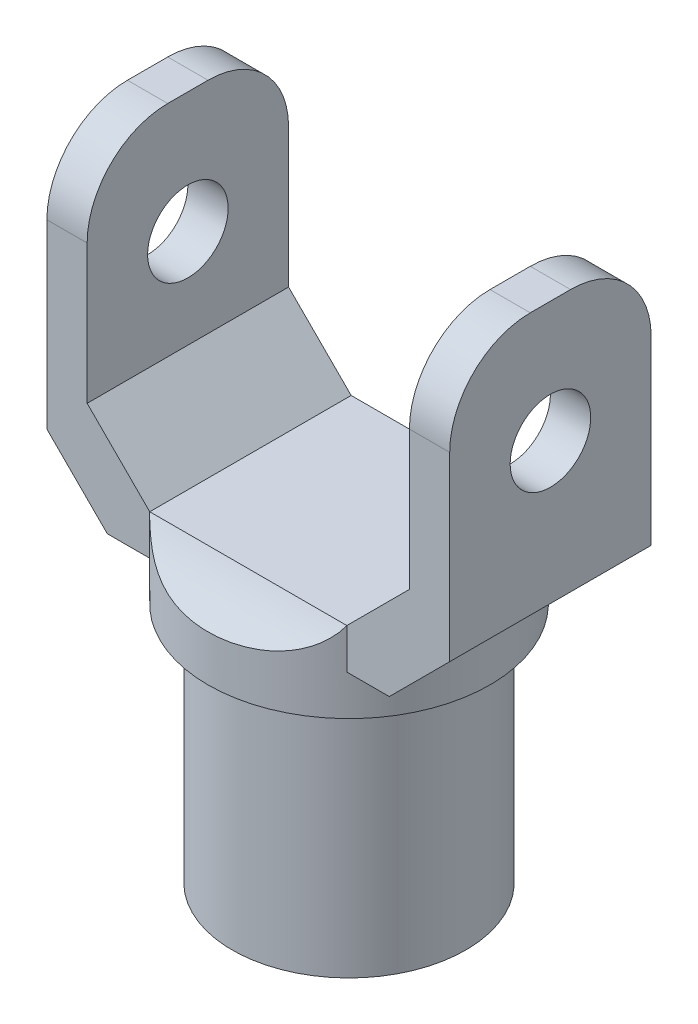
from build123d import *

# Parameters (mm, degrees)
SKETCH2_R           = 18.415
SKETCH2_R_2         = 15.875
BOSS_EXTRUDE1_DEPTH = 38.1
SKETCH3_R           = 22.225
BOSS_EXTRUDE2_DEPTH = 6.35
SKETCH5_W           = 63.5
SKETCH5_H           = 31.75
BOSS_EXTRUDE3_DEPTH = 50.8
CUT_EXTRUDE2_DEPTH  = 50.8
FILLET1_R           = 12.7
SKETCH9_R           = 6.35
CUT_EXTRUDE3_DEPTH  = 117.613734719
FILLET2_R           = 12.7


with BuildPart() as part:
    # Sketch2 → Boss-Extrude1 (new body)
    with BuildSketch(Plane(origin=(0, 0, 0), x_dir=(1, 0, 0), z_dir=(0, 1, 0))):
        with Locations(Location((0, 0, 0), (0, 0, 90))):
            Circle(SKETCH2_R)
        with Locations(Location((0, 0, 0), (0, 0, 90))):
            Circle(SKETCH2_R_2, mode=Mode.SUBTRACT)
    extrude(amount=BOSS_EXTRUDE1_DEPTH)

    # Sketch3 → Boss-Extrude2 (add)
    with BuildSketch(Plane(origin=(0, 38.1, 0), x_dir=(1, 0, 0), z_dir=(0, 1, 0))):
        with Locations(Location((0, 0, 0), (0, 0, 270))):
            Circle(SKETCH3_R)
    extrude(amount=BOSS_EXTRUDE2_DEPTH)

    # Sketch5 → Boss-Extrude3 (add)
    with BuildSketch(Plane(origin=(0, 44.45, 0), x_dir=(1, 0, 0), z_dir=(0, 1, 0))):
        Rectangle(SKETCH5_W, SKETCH5_H)
    extrude(amount=BOSS_EXTRUDE3_DEPTH)

    # Sketch7 → Cut-Extrude2 (cut)
    with BuildSketch(Plane.XY.offset(15.875)):
        Polygon((25.4, 95.25), (-25.4, 95.25), (-25.4, 60.667652482), (-15.532347518, 50.8), (15.532347518, 50.8), (25.4, 60.667652482), align=None)
        Polygon((-22.225, 44.45), (-31.75, 53.975), (-31.75, 44.45), align=None)
        Polygon((22.225, 44.45), (31.75, 53.975), (31.75, 44.45), align=None)
    extrude(amount=-CUT_EXTRUDE2_DEPTH, mode=Mode.SUBTRACT)

    # Fillet1
    fillet1_edges = [part.edges().sort_by_distance(p)[0] for p in [
        (28.575, 95.25, -15.875),
        (-28.575, 95.25, 15.875),
        (-28.575, 95.25, -15.875),
        (28.575, 95.25, 15.875),
    ]]
    fillet(fillet1_edges, radius=FILLET1_R)

    # Sketch9 → Cut-Extrude3 (cut, through all)
    with BuildSketch(Plane.ZY.offset(31.75)):
        with Locations((0, 76.2)):
            Circle(SKETCH9_R)
    extrude(amount=-CUT_EXTRUDE3_DEPTH, mode=Mode.SUBTRACT)

    # Fillet2
    # the kernel refuses this fillet: 12.7 mm, written as the material it adds along each edge
    with BuildSketch(Plane(origin=(-43.050566437, 44.45, 15.875), x_dir=(0, 1, 0), z_dir=(1, 0, 0))) as fillet2_piece_1_section:
        with BuildLine():
            CenterArc((12.7, 10.998522628), FILLET2_R, 180, 60)
            Line((0, 10.998522628), (0, 0))
            Line((0, 0), (6.35, 0))
        make_face()
    fillet2_piece_1 = extrude(amount=86.101132874, mode=Mode.PRIVATE)
    fillet2_piece_1 = fillet2_piece_1 & Plane(origin=(0, 49.09130813, 0), x_dir=(0, 0, 1), z_dir=(0, -1, 0)) * Cylinder(22.225, 217, mode=Mode.PRIVATE)
    add(fillet2_piece_1)
    with BuildSketch(Plane(origin=(43.050566437, 44.45, -15.875), x_dir=(0, 1, 0), z_dir=(-1, 0, 0))) as fillet2_piece_2_section:
        with BuildLine():
            CenterArc((12.7, 10.998522628), FILLET2_R, 180, 60)
            Line((0, 10.998522628), (0, 0))
            Line((0, 0), (6.35, 0))
        make_face()
    fillet2_piece_2 = extrude(amount=86.101132874, mode=Mode.PRIVATE)
    fillet2_piece_2 = fillet2_piece_2 & Plane(origin=(0, 49.09130813, 0), x_dir=(0, 0, 1), z_dir=(0, -1, 0)) * Cylinder(22.225, 217, mode=Mode.PRIVATE)
    add(fillet2_piece_2)


solid = part.part
